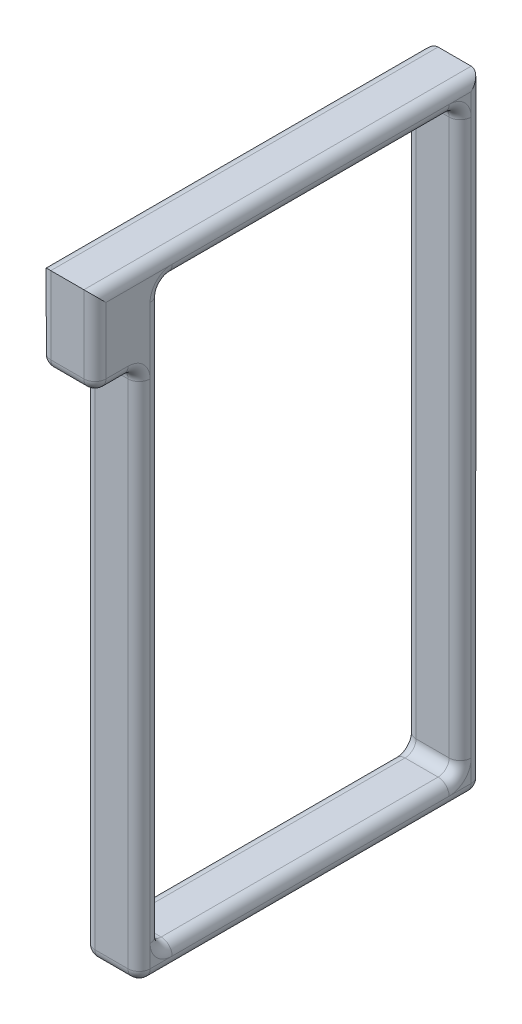
from build123d import *

# Parameters (mm, degrees)
SKETCH1_W           = 39.497
SKETCH1_H           = 71.501
SKETCH1_W_2         = 34.417
SKETCH1_H_2         = 66.421
SKETCH1_W_3         = 5.08
SKETCH1_H_3         = 10.16
BOSS_EXTRUDE1_DEPTH = 3.175
FILLET1_R           = 1.27


with BuildPart() as part:
    # Sketch1 → Boss-Extrude1 (new, symmetric)
    # profile 1 of 2: a face of its own
    with BuildSketch(Plane(origin=(0, 0, 0), x_dir=(0, 0, -1), z_dir=(1, 0, 0))):
        Rectangle(SKETCH1_W, SKETCH1_H)
        Rectangle(SKETCH1_W_2, SKETCH1_H_2, mode=Mode.SUBTRACT)
    # profile 2 of 2: a face of its own
    with BuildSketch(Plane(origin=(0, 0, 0), x_dir=(0, 0, -1), z_dir=(1, 0, 0))):
        with Locations((-22.2885, 30.6705)):
            Rectangle(SKETCH1_W_3, SKETCH1_H_3)
    extrude(amount=BOSS_EXTRUDE1_DEPTH, both=True)

    # Fillet1
    fillet1_edges = [part.edges().sort_by_distance(p)[0] for p in [
        (-3.175, -5.08, 19.7485),
        (-3.175, 25.5905, 22.2885),
        (-3.175, 30.6705, 24.8285),
        (-3.175, 35.7505, 2.54),
        (3.175, 33.2105, 0),
        (-3.175, 0, -19.7485),
        (-3.175, -35.7505, 0),
        (-3.175, 0, -17.2085),
        (-3.175, 33.2105, 0),
        (-3.175, 0, 17.2085),
        (-3.175, -33.2105, 0),
        (3.175, 0, -17.2085),
        (0, -35.7505, 19.7485),
        (0, 25.5905, 19.7485),
        (0, 25.5905, 24.8285),
        (0, -35.7505, -19.7485),
        (0, -33.2105, -17.2085),
        (0, 33.2105, -17.2085),
        (0, 33.2105, 17.2085),
        (0, -33.2105, 17.2085),
        (3.175, -35.7505, 0),
        (3.175, 0, -19.7485),
        (3.175, 35.7505, 2.54),
        (3.175, 30.6705, 24.8285),
        (3.175, 25.5905, 22.2885),
        (3.175, -5.08, 19.7485),
        (3.175, -33.2105, 0),
        (3.175, 0, 17.2085),
    ]]
    fillet(fillet1_edges, radius=FILLET1_R - 0.0001)  # a hair under: the kernel refuses the full size


solid = part.part
